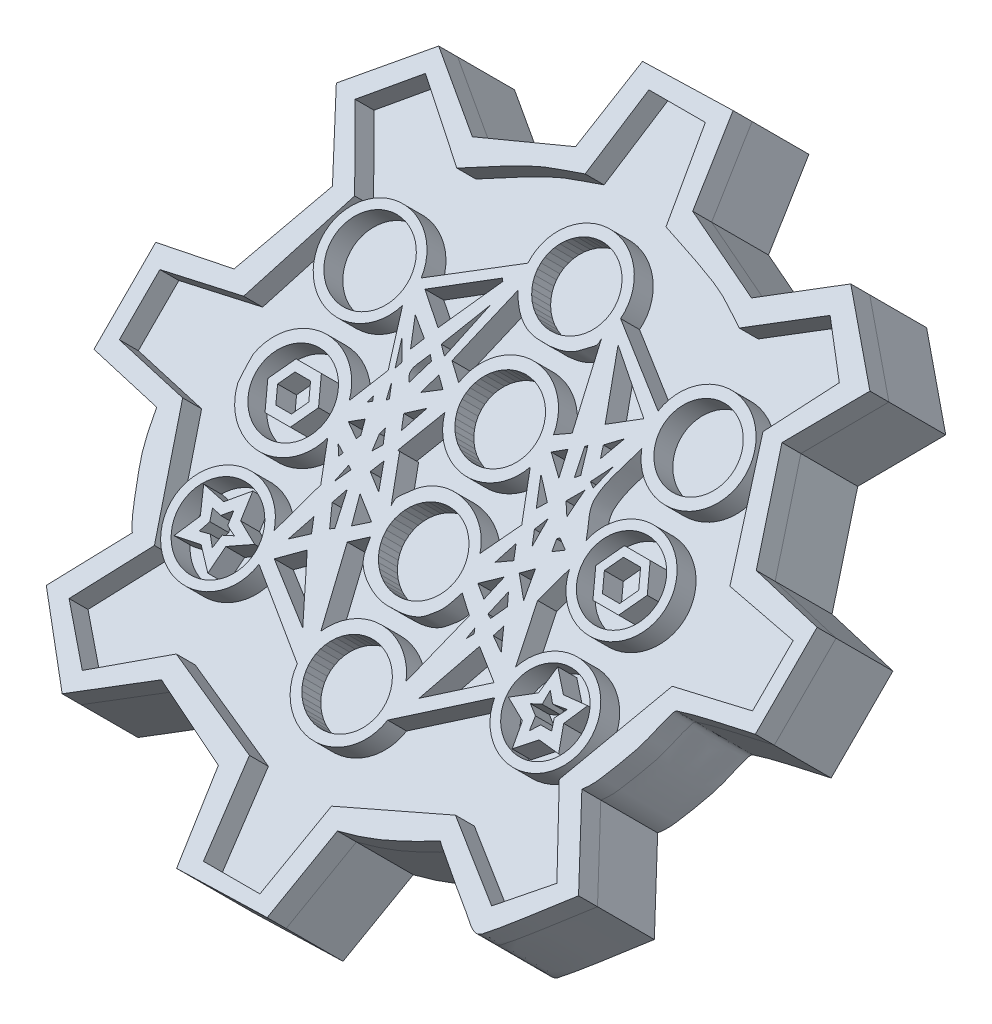
from build123d import *

# Parameters (mm, degrees)
SKETCH3_R                       = 12.7
BOSS_EXTRUDE1_DEPTH             = 4.7625
BOSS_EXTRUDE2_REACH             = 31.48
SKETCH2_R                       = 6.0325
BOSS_EXTRUDE2_DIRECTION_2_DEPTH = 3.175
BOSS_EXTRUDE3_DEPTH             = 4.7625
BOSS_EXTRUDE4_DEPTH             = 1.5875
SKETCH5_3_R                     = 2.164212429
SKETCH5_3_R_2                   = 2.267249673
SKETCH5_3_R_3                   = 2.236755997
SKETCH5_3_R_4                   = 2.162543778
SKETCH5_3_R_5                   = 2.19194465
SKETCH5_3_R_6                   = 2.185022377
BOSS_EXTRUDE4_2_DEPTH           = 1.5875
BOSS_EXTRUDE4_3_DEPTH           = 1.5875
BOSS_EXTRUDE4_4_DEPTH           = 1.5875
BOSS_EXTRUDE4_5_DEPTH           = 1.5875
BOSS_EXTRUDE4_6_DEPTH           = 1.5875
SKETCH6_R                       = 2.999994
CUT_EXTRUDE1_DEPTH              = 3


with BuildPart() as part:
    # Sketch3 → Boss-Extrude1 (new body)
    with BuildSketch(Plane(origin=(0, 0, 0), x_dir=(1, 0, 0), z_dir=(0, 0.7071067811865464, 0.7071067811865488))):
        Circle(SKETCH3_R)
    extrude(amount=BOSS_EXTRUDE1_DEPTH)

    # Boss-Extrude2: up to this plane
    boss_extrude2_end = Plane(origin=(0, 0, 0), z_dir=(0, 0.7071067811865464, 0.7071067811865488))
    # Sketch2 → Boss-Extrude2 (add, up to the surface)
    with BuildSketch(Plane(origin=(0, -6.35, 0), x_dir=(1, 0, 0), z_dir=(0, 1, 0)), mode=Mode.PRIVATE) as boss_extrude2_sk1:
        Circle(SKETCH2_R)
    boss_extrude2_tool1 = split(extrude(boss_extrude2_sk1.sketch, amount=BOSS_EXTRUDE2_REACH, mode=Mode.PRIVATE), bisect_by=boss_extrude2_end, keep=Keep.BOTH, mode=Mode.PRIVATE)
    add(boss_extrude2_tool1.solids().sort_by_distance((0, -6.35, 0))[0])

    # Sketch2 → Boss-Extrude2 direction 2 (add)
    with BuildSketch(Plane(origin=(0, -6.35, 0), x_dir=(1, 0, 0), z_dir=(0, 1, 0))):
        Circle(SKETCH2_R)
    extrude(amount=-BOSS_EXTRUDE2_DIRECTION_2_DEPTH)

    # Sketch5 → Boss-Extrude3 (add)
    with BuildSketch(Plane(origin=(0, 3.367596045, 3.367596045), x_dir=(1, 0, 0), z_dir=(0, 0.7071067811865465, 0.7071067811865487))):
        with BuildLine():
            Line((2.37588296, -19.954888549), (3.27588296, -15.342388549))
            add(Edge.make_bspline(
                [(3.27588296, -15.342388549), (5.213140651, -14.95493701), (6.365125302, -14.416517378), (8.11338296, -13.542388549)],
                knots=[0, 0, 0, 0, 1, 1, 1, 1], degree=3))
            add(Edge.make_bspline(
                [(8.11338296, -13.542388549), (8.15088296, -13.579888549), (8.182279635, -13.624701631), (8.22588296, -13.654888549), (9.105957707, -14.264171065), (10.140890335, -14.984018342), (11.03838296, -15.567388549), (11.335002757, -15.760191417), (11.602763198, -16.018015294), (11.93838296, -16.129888549), (12.085065014, -16.178782567), (12.275691051, -16.123250645), (12.38838296, -16.017388549), (13.528810411, -14.946077913), (14.56338296, -13.767388549), (15.65088296, -12.642388549)],
                knots=[0, 0, 0, 0, 1, 1, 1, 2, 2, 2, 3, 3, 3, 4, 4, 4, 5, 5, 5, 5], degree=3))
            Line((15.65088296, -12.642388549), (13.06338296, -8.704888549))
            add(Edge.make_bspline(
                [(13.06338296, -8.704888549), (13.291037029, -8.47723448), (13.486673387, -8.195807695), (13.62588296, -7.917388549), (13.940972233, -7.287210002), (14.267644067, -6.660418047), (14.52588296, -6.004888549), (14.756285605, -5.420020297), (14.871067542, -4.794744683), (15.08838296, -4.204888549), (15.13512515, -4.07801689), (15.182626579, -3.901798123), (15.31338296, -3.867388549), (16.643385158, -3.51738797), (18.01338296, -3.342388549), (19.36338296, -3.079888549)],
                knots=[0, 0, 0, 0, 1, 1, 1, 2, 2, 2, 3, 3, 3, 4, 4, 4, 5, 5, 5, 5], degree=3))
            Line((19.36338296, -3.079888549), (19.36338296, 2.095111451))
            Line((19.36338296, 2.095111451), (15.20088296, 2.882611451))
            Line((15.20088296, 2.882611451), (13.06338296, 8.057611451))
            Line((13.06338296, 8.057611451), (15.65088296, 11.770111451))
            Line((15.65088296, 11.770111451), (12.05088296, 15.257611451))
            Line((12.05088296, 15.257611451), (8.00088296, 12.670111451))
            Line((8.00088296, 12.670111451), (3.16338296, 14.582611451))
            Line((3.16338296, 14.582611451), (2.37588296, 19.082611451))
            Line((2.37588296, 19.082611451), (-2.91161704, 18.970111451))
            Line((-2.91161704, 18.970111451), (-3.69911704, 14.470111451))
            Line((-3.69911704, 14.470111451), (-8.53661704, 12.670111451))
            Line((-8.53661704, 12.670111451), (-12.36161704, 15.257611451))
            Line((-12.36161704, 15.257611451), (-15.96161704, 11.770111451))
            Line((-15.96161704, 11.770111451), (-13.48661704, 7.945111451))
            Line((-13.48661704, 7.945111451), (-15.73661704, 2.882611451))
            Line((-15.73661704, 2.882611451), (-19.89911704, 2.207611451))
            Line((-19.89911704, 2.207611451), (-19.89911704, -2.967388549))
            Line((-19.89911704, -2.967388549), (-15.62411704, -3.754888549))
            add(Edge.make_bspline(
                [(-15.62411704, -3.754888549), (-15.432011284, -4.715417329), (-15.179098428, -5.714298445), (-14.72411704, -6.567388549), (-14.604852353, -6.791009836), (-13.923408311, -8.380597277), (-13.48661704, -8.817388549)],
                knots=[0, 0, 0, 0, 1, 1, 1, 2, 2, 2, 2], degree=3))
            Line((-13.48661704, -8.817388549), (-15.96161704, -12.529888549))
            Line((-15.96161704, -12.529888549), (-12.47411704, -16.129888549))
            Line((-12.47411704, -16.129888549), (-8.42411704, -13.542388549))
            Line((-8.42411704, -13.542388549), (-3.69911704, -15.454888549))
            Line((-3.69911704, -15.454888549), (-2.91161704, -20.067388549))
            Line((-2.91161704, -20.067388549), (2.37588296, -19.954888549))
        make_face()
    extrude(amount=-BOSS_EXTRUDE3_DEPTH)

    # Sketch6 → Cut-Extrude1 (cut)
    with BuildSketch(Plane(origin=(0, 0, 0), x_dir=(1, 0, 0), z_dir=(0, -0.7071067811865465, -0.7071067811865487))):
        with Locations((0, -12.7)):
            Circle(SKETCH6_R)
    extrude(amount=-CUT_EXTRUDE1_DEPTH, mode=Mode.SUBTRACT)


with BuildPart() as body_2:
    # Sketch5<3> → Boss-Extrude4 (new body)
    with BuildSketch(Plane(origin=(0, 3.367596045, 3.367596045), x_dir=(1, 0, 0), z_dir=(0, 0.7071067811865465, 0.7071067811865487))):
        Polygon((10.570890724, -6.699628222), (11.181545438, -5.554406631), (9.824774814, -5.667338587), (8.852559914, -4.767388549), (8.666425604, -6.118183773), (7.439656446, -6.909637779), (8.666425604, -7.467473287), (8.932946283, -8.704888549), (9.906098908, -7.810704156), (11.123321766, -7.911532023), align=None)
        Polygon((9.122543013, -6.456478997), (9.122543013, -5.779888549), (9.579223769, -6.227001566), (10.374688716, -6.118183773), (10.011049339, -6.699628222), (10.232974046, -7.236125629), (9.579223769, -7.236125629), (9.234575608, -7.689732748), (9.122543013, -7.017537179), (8.582576814, -6.679838587), align=None, mode=Mode.SUBTRACT)
    extrude(amount=BOSS_EXTRUDE4_DEPTH)


with BuildPart() as body_3:
    # Sketch5<3> → Boss-Extrude4 2 (new body)
    with BuildSketch(Plane(origin=(0, 3.367596045, 3.367596045), x_dir=(1, 0, 0), z_dir=(0, 0.7071067811865465, 0.7071067811865487))):
        with BuildLine():
            Line((6.988377513, -5.667338587), (6.257391832, -2.786733685))
            Line((6.257391832, -2.786733685), (6.867974577, -0.979023088))
            ThreePointArc((6.867974577, -0.979023088), (12.159341193, -0.315814658), (6.875877513, 0.407661413))
            add(Edge.make_bspline(
                [(6.875877513, 0.407661413), (6.646620756, 0.973201954), (6.172855969, 1.494232085), (6.188107242, 2.104283035), (6.212394376, 3.075768384), (6.721620756, 3.973201954), (6.988377513, 4.907661413)],
                knots=[0, 0, 0, 0, 1, 1, 1, 2, 2, 2, 2], degree=3))
            ThreePointArc((6.988377513, 4.907661413), (12.246789662, 6.50864779), (6.750977209, 6.609152497))
            Line((6.750977209, 6.609152497), (2.713377513, 9.176441506))
            ThreePointArc((2.713377513, 9.176441506), (-0.017601471, 12.204350888), (-2.827037997, 9.249093227))
            Line((-2.827037997, 9.249093227), (-7.186622487, 6.474842305))
            ThreePointArc((-7.186622487, 6.474842305), (-12.644887327, 6.28918741), (-7.315855358, 5.093971497))
            Line((-7.315855358, 5.093971497), (-6.286622487, 2.432661413))
            Line((-6.286622487, 2.432661413), (-7.240094631, 0.520111451))
            ThreePointArc((-7.240094631, 0.520111451), (-10.092764681, 2.447488248), (-12.698465553, 0.197414763))
            ThreePointArc((-12.698465553, 0.197414763), (-12.690708308, -0.485718674), (-12.646227442, -1.167446567))
            ThreePointArc((-12.646227442, -1.167446567), (-9.984507764, -3.211589629), (-7.240094631, -1.279888549))
            Line((-7.240094631, -1.279888549), (-6.345896802, -3.132498155))
            Line((-6.345896802, -3.132498155), (-7.240094631, -5.779888549))
            ThreePointArc((-7.240094631, -5.779888549), (-12.551776002, -7.198833198), (-7.054876576, -7.305882736))
            Line((-7.054876576, -7.305882736), (-2.79911704, -10.115380309))
            ThreePointArc((-2.79911704, -10.115380309), (-0.134807774, -12.572630384), (2.66194435, -10.267245524))
            Line((2.66194435, -10.267245524), (6.843032471, -7.211437421))
            ThreePointArc((6.843032471, -7.211437421), (12.138764723, -6.931031297), (6.988377513, -5.667338587))
        make_face()
        with Locations((9.470174405, -6.679838587)):
            Circle(SKETCH5_3_R, mode=Mode.SUBTRACT)
        Polygon((2.086283035, 8.892595719), (1.995970472, 8.618267693), (1.869075517, 8.358352817), (1.707862615, 8.117489279), (1.515208612, 7.899975294), (1.294551424, 7.709692405), (1.049828685, 7.550036214), (0.785407476, 7.42385579), (0.506006401, 7.333402825), (0.216611379, 7.280291454), (-0.077613329, 7.265469452), (-0.371417277, 7.289201317), (-0.659557526, 7.351063554), (-0.936892207, 7.449952229), (-1.198472275, 7.584102672), (-1.439629828, 7.751120965), (-1.656061404, 7.948026663), (-1.843904777, 8.171305978), (-1.999807876, 8.416974486), (-2.120988607, 8.680648227), (-2.205284497, 8.957621936), (-2.251191285, 9.242953011), (-2.257889762, 9.531549713), (-2.225260394, 9.818262026), (-2.153885452, 10.097973563), (-2.045038625, 10.365692863), (-1.900662287, 10.616642471), (-1.723332836, 10.846344184), (-1.516214721, 11.05069897), (-1.283003969, 11.226060113), (-1.027862233, 11.369298289), (-0.755342521, 11.47785741), (-0.470307956, 11.549800234), (-0.177844985, 11.583842942), (0.116827382, 11.57937804), (0.408450711, 11.536485204), (0.691820976, 11.455929858), (0.961881428, 11.339149514), (1.213812832, 11.188228121), (1.443119466, 11.005858873), (1.645709348, 10.795296155), (1.817967257, 10.560297462), (1.956819245, 10.305056353), (2.059787497, 10.034127612), (2.12503454, 9.752345967), (2.151396041, 9.464739819), (2.138401577, 9.176441506), align=None, mode=Mode.SUBTRACT)
        with Locations((-9.79576947, -6.864321983)):
            Circle(SKETCH5_3_R_2, mode=Mode.SUBTRACT)
        with Locations((-9.903872161, 6.032661413)):
            Circle(SKETCH5_3_R_3, mode=Mode.SUBTRACT)
        with Locations((9.490932706, 6.124137237)):
            Circle(SKETCH5_3_R_4, mode=Mode.SUBTRACT)
        Polygon((-6.51161704, -6.792388549), (-5.27411704, -5.779888549), (-3.47411704, -8.704888549), align=None, mode=Mode.SUBTRACT)
        Polygon((-6.39911704, -5.779888549), (-5.83661704, -4.429888549), (-5.49911704, -5.104888549), align=None, mode=Mode.SUBTRACT)
        Polygon((-5.83661704, -2.742388549), (-5.61161704, -1.842388549), (-5.38661704, -1.954888549), align=None, mode=Mode.SUBTRACT)
        Polygon((-6.28661704, -1.729888549), (-6.62411704, -1.279888549), (-6.17411704, -1.504888549), align=None, mode=Mode.SUBTRACT)
        Polygon((-5.04911704, -2.742388549), (-4.59911704, -4.429888549), (-4.82411704, -4.542388549), (-5.38661704, -3.529888549), align=None, mode=Mode.SUBTRACT)
        Polygon((-3.92411704, -3.979888549), (-4.37411704, -2.629888549), (-3.13661704, -3.417388549), align=None, mode=Mode.SUBTRACT)
        Polygon((-4.48661704, -1.617388549), (-4.14911704, -0.942388549), (-3.58661704, -2.179888549), align=None, mode=Mode.SUBTRACT)
        Polygon((2.147744199, -9.976082924), (2.10982956, -10.257453458), (2.034819966, -10.531279057), (1.923998852, -10.792874487), (1.779262397, -11.037763779), (1.603087082, -11.261756809), (1.398487315, -11.461020993), (1.168963856, -11.632146868), (0.918443914, -11.772206421), (0.651213956, -11.878803194), (0.371846359, -11.950113288), (0.085121181, -11.984916567), (-0.204055631, -11.982617537), (-0.490736181, -11.943255535), (-0.770015287, -11.867504056), (-1.037114404, -11.756659229), (-1.287463393, -11.612617639), (-1.516778713, -11.437843878), (-1.721136716, -11.235328374), (-1.89704078, -11.008536222), (-2.041481136, -10.7613479), (-2.151986372, -10.497992868), (-2.22666571, -10.222977204), (-2.264241368, -9.941006503), (-2.264070416, -9.65690536), (-2.226155778, -9.375534825), (-2.151146184, -9.101709227), (-2.040325069, -8.840113797), (-1.895588614, -8.595224505), (-1.719413299, -8.371231475), (-1.514813532, -8.17196729), (-1.285290073, -8.000841416), (-1.034770132, -7.860781863), (-0.767540173, -7.754185089), (-0.488172576, -7.682874995), (-0.201447398, -7.648071716), (0.087729414, -7.650370746), (0.374409964, -7.689732748), (0.653689069, -7.765484227), (0.920788186, -7.876329055), (1.171137175, -8.020370645), (1.400452496, -8.195144406), (1.604810499, -8.39765991), (1.780714562, -8.624452061), (1.925154919, -8.871640383), (2.035660154, -9.134995415), (2.110339493, -9.410011079), (2.147915151, -9.691981781), align=None, mode=Mode.SUBTRACT)
        with BuildLine():
            Line((2.71338296, -4.092388549), (3.61338296, -4.767388549))
            Line((3.61338296, -4.767388549), (2.48838296, -8.479888549))
            ThreePointArc((2.48838296, -8.479888549), (-0.037226803, -6.940564194), (-2.584979764, -8.442955287))
            Line((-2.584979764, -8.442955287), (-3.69911704, -4.654888549))
            Line((-3.69911704, -4.654888549), (-2.79911704, -3.979888549))
            add(Edge.make_bspline(
                [(-2.79911704, -3.979888549), (-2.72411704, -4.279888549), (-2.702078533, -4.598373263), (-2.57411704, -4.879888549), (-2.244749101, -5.604498013), (-1.049876309, -6.117388549), (-0.32411704, -6.117388549), (0.281227234, -6.117388549), (1.174640055, -6.141007164), (1.70088296, -5.667388549), (2.40158335, -5.036758198), (2.371991785, -4.888967958), (2.71338296, -4.092388549)],
                knots=[0, 0, 0, 0, 1, 1, 1, 2, 2, 2, 3, 3, 3, 4, 4, 4, 4], degree=3))
        make_face(mode=Mode.SUBTRACT)
        Polygon((4.28838296, -5.329888549), (4.06338296, -5.667388549), (4.17588296, -5.104888549), align=None, mode=Mode.SUBTRACT)
        Polygon((3.50088296, -8.817388549), (4.85088296, -5.667388549), (6.42588296, -6.679888549), align=None, mode=Mode.SUBTRACT)
        Polygon((2.143239875, -3.246781578), (2.144666797, -3.535728761), (2.106749627, -3.82218085), (2.030164996, -4.101026099), (1.916279561, -4.367288509), (1.767125608, -4.616216622), (1.585364794, -4.843368308), (1.374240645, -5.04469004), (1.137520676, -5.216589228), (0.879429161, -5.355998326), (0.604571749, -5.460429576), (0.317853277, -5.5280194), (0.024390243, -5.557561655), (-0.270580499, -5.548529159), (-0.561795188, -5.501083098), (-0.844057091, -5.416070147), (-1.112329239, -5.295007365), (-1.361824307, -5.14005512), (-1.588090052, -4.953978538), (-1.787088755, -4.740098161), (-1.955269279, -4.502230688), (-2.08963044, -4.244620871), (-2.187774558, -3.971865762), (-2.247950251, -3.688832684), (-2.269083681, -3.400572368), (-2.250797722, -3.112228826), (-2.193418687, -2.828947555), (-2.097970507, -2.555783717), (-1.966156456, -2.297611927), (-1.800328759, -2.059039266), (-1.603446616, -1.84432307), (-1.379023393, -1.657294953), (-1.131063927, -1.501292437), (-0.863993062, -1.379099391), (-0.582576683, -1.292896353), (-0.291836672, -1.244221617), (0.003038708, -1.233943786), (0.2967874, -1.262246267), (0.584167451, -1.328624002), (0.860050557, -1.43189248), (1.119513577, -1.57020887), (1.357926388, -1.741104915), (1.571034508, -1.941530971), (1.755035017, -2.167910429), (1.906644422, -2.416203542), (2.023157249, -2.681979515), (2.102494324, -2.960495569), align=None, mode=Mode.SUBTRACT)
        Polygon((3.16338296, -3.417388549), (4.17588296, -2.629888549), (3.83838296, -3.867388549), align=None, mode=Mode.SUBTRACT)
        Polygon((3.38838296, -2.292388549), (3.83838296, -1.167388549), (4.17588296, -1.842388549), align=None, mode=Mode.SUBTRACT)
        Polygon((5.18838296, -4.992388549), (5.41338296, -4.429888549), (5.97588296, -5.442388549), align=None, mode=Mode.SUBTRACT)
        Polygon((4.73838296, -3.079888549), (5.07588296, -3.642388549), (4.62588296, -4.429888549), (4.40088296, -4.317388549), align=None, mode=Mode.SUBTRACT)
        Polygon((5.63838296, -3.079888549), (4.738381017, -2.179886172), (5.346979202, -1.682292834), align=None, mode=Mode.SUBTRACT)
        with Locations((-9.925611304, -0.379888549)):
            Circle(SKETCH5_3_R_5, mode=Mode.SUBTRACT)
        Polygon((-6.06161704, 0.182611451), (-5.83661704, -0.492388549), (-5.94911704, -0.717388549), (-6.73661704, -0.267388549), align=None, mode=Mode.SUBTRACT)
        Polygon((-6.39911704, 0.857611451), (-6.28661704, 1.195111451), (-6.17411704, 0.970111451), align=None, mode=Mode.SUBTRACT)
        Polygon((-5.61161704, 1.307611451), (-5.83661704, 2.095111451), (-5.49911704, 1.420111451), align=None, mode=Mode.SUBTRACT)
        Polygon((-6.033027308, 2.657611451), (-6.51161704, 3.895111451), (-5.885439958, 3.001981935), align=None, mode=Mode.SUBTRACT)
        Polygon((-5.83661704, 3.670111451), (-6.51161704, 5.020111451), (-5.49911704, 4.345111451), align=None, mode=Mode.SUBTRACT)
        Polygon((-4.93661704, 0.295111451), (-4.59911704, -0.379888549), (-4.93661704, -0.829888549), (-5.04911704, -0.042388549), align=None, mode=Mode.SUBTRACT)
        Polygon((-4.48661704, 1.195111451), (-3.58661704, 1.870111451), (-4.14911704, 0.520111451), align=None, mode=Mode.SUBTRACT)
        with BuildLine():
            add(Edge.make_bspline(
                [(-5.04911704, 2.432611451), (-5.534077752, 2.917572164), (-5.084789319, 3.308598822), (-4.82411704, 3.895111451)],
                knots=[0, 0, 0, 0, 1, 1, 1, 1], degree=3))
            Line((-4.82411704, 3.895111451), (-4.59911704, 3.670111451))
            Line((-4.59911704, 3.670111451), (-5.04911704, 2.432611451))
        make_face(mode=Mode.SUBTRACT)
        Polygon((-4.26161704, 2.320111451), (-3.92411704, 3.332611451), (-3.36161704, 2.882611451), align=None, mode=Mode.SUBTRACT)
        Polygon((-4.59911704, 4.492982269), (-3.423837336, 6.9255138), (-4.14911704, 4.120111451), align=None, mode=Mode.SUBTRACT)
        Polygon((-3.58661704, 8.170111451), (-3.47411704, 8.057611451), (-5.16161704, 5.020111451), (-6.73661704, 6.145111451), align=None, mode=Mode.SUBTRACT)
        with BuildLine():
            ThreePointArc((-2.68661704, 2.095111451), (-0.156302139, 0.21820356), (2.506576456, 1.901757632))
            Line((2.506576456, 1.901757632), (3.61338296, -0.379888549))
            Line((3.61338296, -0.379888549), (2.48838296, -2.292388549))
            add(Edge.make_bspline(
                [(2.48838296, -2.292388549), (1.799772389, -0.57086212), (-0.800285482, 0.051791332), (-2.12411704, -1.392388549), (-2.706492, -2.027706687), (-2.68661704, -1.970041264), (-2.68661704, -2.404888549)],
                knots=[0, 0, 0, 0, 1, 1, 1, 2, 2, 2, 2], degree=3))
            Line((-2.68661704, -2.404888549), (-3.69911704, -0.267388549))
            Line((-3.69911704, -0.267388549), (-3.81161704, -0.267388549))
            Line((-3.81161704, -0.267388549), (-2.68661704, 2.095111451))
        make_face(mode=Mode.SUBTRACT)
        Polygon((4.28838296, -0.267388549), (4.62588296, 0.407611451), (4.62588296, -0.942388549), align=None, mode=Mode.SUBTRACT)
        Polygon((3.83838296, 0.520111451), (3.16338296, 1.870111451), (4.17588296, 0.970111451), align=None, mode=Mode.SUBTRACT)
        Polygon((2.146014273, 3.211428094), (2.155332248, 2.922453784), (2.125248619, 2.634898655), (2.05630023, 2.353894137), (1.949717466, 2.084454761), (1.807402299, 1.831388679), (1.631894347, 1.599211861), (1.426325553, 1.392067509), (1.194364297, 1.213652117), (0.940149934, 1.067149514), (0.668218924, 0.955174041), (0.383423883, 0.879723903), (0.090846985, 0.84214551), (-0.204290727, 0.84310945), (-0.496722516, 0.88259852), (-0.781229928, 0.959908037), (-1.052735921, 1.073658411), (-1.306395466, 1.221819765), (-1.537682002, 1.401748154), (-1.742468214, 1.610232753), (-1.917099688, 1.84355315), (-2.058460121, 2.097545735), (-2.164026933, 2.367678006), (-2.231916282, 2.649129446), (-2.26091668, 2.936877546), (-2.250510615, 3.225787436), (-2.200883784, 3.510703511), (-2.112921777, 3.786541438), (-1.98819428, 4.048378882), (-1.828927058, 4.291543348), (-1.637962237, 4.51169556), (-1.41870759, 4.704906896), (-1.175075721, 4.867729496), (-0.911414246, 4.997257787), (-0.632428211, 5.091180332), (-0.343096128, 5.147821083), (-0.048581135, 5.166169284), (0.245861141, 5.14589751), (0.53497637, 5.087367511), (0.813605286, 4.991623758), (1.076775746, 4.860374799), (1.31979147, 4.695962776), (1.538315835, 4.501321624), (1.728449269, 4.27992472), (1.886798837, 4.035722897), (2.010538786, 3.773073942), (2.097460974, 3.496664832), align=None, mode=Mode.SUBTRACT)
        Polygon((3.05088296, 2.882611451), (3.72588296, 3.332611451), (4.06338296, 2.095111451), align=None, mode=Mode.SUBTRACT)
        Polygon((5.63838296, -0.042388549), (6.20088296, -0.379888549), (5.63838296, -0.717388549), (5.52588296, -0.154888549), align=None, mode=Mode.SUBTRACT)
        Polygon((4.96338296, 1.420111451), (5.52588296, 2.207611451), (5.41338296, 0.857611451), align=None, mode=Mode.SUBTRACT)
        with Locations((9.470174405, -0.300488668)):
            Circle(SKETCH5_3_R_6, mode=Mode.SUBTRACT)
        Polygon((4.51338296, 3.895111451), (4.96338296, 2.657611451), (4.73838296, 2.432611451), (4.40088296, 3.782611451), align=None, mode=Mode.SUBTRACT)
        Polygon((5.555032171, 2.634015446), (6.20088296, 3.670111451), (5.850584864, 2.449782577), align=None, mode=Mode.SUBTRACT)
        Polygon((5.41338296, 3.670111451), (5.18838296, 4.232611451), (5.97588296, 4.907611451), align=None, mode=Mode.SUBTRACT)
        with BuildLine():
            Line((-2.836449285, 3.460448099), (-3.69911704, 4.120111451))
            Line((-3.69911704, 4.120111451), (-2.57411704, 8.057611451))
            add(Edge.make_bspline(
                [(-2.57411704, 8.057611451), (-2.104555386, 7.35326897), (-1.472413375, 6.784552813), (-0.54911704, 6.707611451), (0.036130665, 6.658840809), (1.139737372, 6.652580422), (1.70088296, 7.157611451), (2.400287637, 7.78707566), (2.37588296, 7.619608158), (2.37588296, 8.057611451)],
                knots=[0, 0, 0, 0, 1, 1, 1, 2, 2, 2, 3, 3, 3, 3], degree=3))
            Line((2.37588296, 8.057611451), (3.50088296, 4.007611451))
            Line((3.50088296, 4.007611451), (2.71338296, 3.557611451))
            ThreePointArc((2.71338296, 3.557611451), (-0.102042107, 5.822842974), (-2.836449285, 3.460448099))
        make_face(mode=Mode.SUBTRACT)
        Polygon((4.73838296, 5.020111451), (3.27588296, 8.170111451), (6.31338296, 6.032611451), align=None, mode=Mode.SUBTRACT)
    extrude(amount=BOSS_EXTRUDE4_2_DEPTH)


with BuildPart() as body_4:
    # Sketch5<3> → Boss-Extrude4 3 (new body)
    with BuildSketch(Plane(origin=(0, 3.367596045, 3.367596045), x_dir=(1, 0, 0), z_dir=(0, 0.7071067811865465, 0.7071067811865487))):
        Polygon((-10.223239103, -5.779888549), (-11.565133918, -5.554406631), (-10.89418651, -6.792388549), (-11.565133918, -8.050683032), (-10.125260658, -7.810704156), (-9.093916405, -8.704888549), (-8.982373433, -7.358309879), (-7.75416355, -6.67676448), (-8.982373433, -6.118273846), (-9.205459377, -4.779758182), align=None)
        Polygon((-9.994219036, -7.236125629), (-10.561502054, -7.358309879), (-10.328724005, -6.792388549), (-10.561502054, -6.229653462), (-10.007255874, -6.343684972), (-9.548477936, -5.892862721), (-9.437098321, -6.561140411), (-8.874896454, -6.792388549), (-9.437098321, -7.026887009), (-9.548477936, -7.689732748), align=None, mode=Mode.SUBTRACT)
    extrude(amount=BOSS_EXTRUDE4_3_DEPTH)


with BuildPart() as body_5:
    # Sketch5<3> → Boss-Extrude4 4 (new body)
    with BuildSketch(Plane(origin=(0, 3.367596045, 3.367596045), x_dir=(1, 0, 0), z_dir=(0, 0.7071067811865465, 0.7071067811865487))):
        Polygon((8.707374763, 1.020719067), (7.944575122, -0.300488668), (8.707374763, -1.621696403), (10.232974046, -1.621696403), (10.995773687, -0.300488668), (10.232974046, 1.020719067), align=None)
        Polygon((9.978680341, 0.58026945), (10.487186278, -0.300488668), (9.978680341, -1.181246786), (8.961668468, -1.181246786), (8.453162531, -0.300488668), (8.961668468, 0.58026945), align=None, mode=Mode.SUBTRACT)
    extrude(amount=BOSS_EXTRUDE4_4_DEPTH)


with BuildPart() as body_6:
    # Sketch5<3> → Boss-Extrude4 5 (new body)
    with BuildSketch(Plane(origin=(0, 3.367596045, 3.367596045), x_dir=(1, 0, 0), z_dir=(0, 0.7071067811865465, 0.7071067811865487))):
        Polygon((-10.676358436, 0.920443628), (-11.427105569, -0.379888549), (-10.676358436, -1.680220725), (-9.174864172, -1.680220725), (-8.42411704, -0.379888549), (-9.174864172, 0.920443628), align=None)
        Polygon((-9.463498762, 0.420513853), (-9.00138622, -0.379888549), (-9.463498762, -1.18029095), (-10.387723846, -1.18029095), (-10.849836388, -0.379888549), (-10.387723846, 0.420513853), align=None, mode=Mode.SUBTRACT)
    extrude(amount=BOSS_EXTRUDE4_5_DEPTH)


with BuildPart() as body_7:
    # Sketch5<3> → Boss-Extrude4 6 (new body)
    with BuildSketch(Plane(origin=(0, 3.367596045, 3.367596045), x_dir=(1, 0, 0), z_dir=(0, 0.7071067811865465, 0.7071067811865487))):
        with BuildLine():
            Line((-2.91161704, -20.067388549), (2.37588296, -19.954888549))
            Line((2.37588296, -19.954888549), (3.27588296, -15.342388549))
            add(Edge.make_bspline(
                [(3.27588296, -15.342388549), (5.213140651, -14.95493701), (6.365125302, -14.416517378), (8.11338296, -13.542388549)],
                knots=[0, 0, 0, 0, 1, 1, 1, 1], degree=3))
            add(Edge.make_bspline(
                [(8.11338296, -13.542388549), (8.15088296, -13.579888549), (8.182279635, -13.624701631), (8.22588296, -13.654888549), (9.105957707, -14.264171065), (10.140890335, -14.984018342), (11.03838296, -15.567388549), (11.335002757, -15.760191417), (11.602763198, -16.018015294), (11.93838296, -16.129888549), (12.085065014, -16.178782567), (12.275691051, -16.123250645), (12.38838296, -16.017388549), (13.528810411, -14.946077913), (14.56338296, -13.767388549), (15.65088296, -12.642388549)],
                knots=[0, 0, 0, 0, 1, 1, 1, 2, 2, 2, 3, 3, 3, 4, 4, 4, 5, 5, 5, 5], degree=3))
            Line((15.65088296, -12.642388549), (13.06338296, -8.704888549))
            add(Edge.make_bspline(
                [(13.06338296, -8.704888549), (13.291037029, -8.47723448), (13.486673387, -8.195807695), (13.62588296, -7.917388549), (13.940972233, -7.287210002), (14.267644067, -6.660418047), (14.52588296, -6.004888549), (14.756285605, -5.420020297), (14.871067542, -4.794744683), (15.08838296, -4.204888549), (15.13512515, -4.07801689), (15.182626579, -3.901798123), (15.31338296, -3.867388549), (16.643385158, -3.51738797), (18.01338296, -3.342388549), (19.36338296, -3.079888549)],
                knots=[0, 0, 0, 0, 1, 1, 1, 2, 2, 2, 3, 3, 3, 4, 4, 4, 5, 5, 5, 5], degree=3))
            Line((19.36338296, -3.079888549), (19.36338296, 2.095111451))
            Line((19.36338296, 2.095111451), (15.20088296, 2.882611451))
            Line((15.20088296, 2.882611451), (13.06338296, 8.057611451))
            Line((13.06338296, 8.057611451), (15.65088296, 11.770111451))
            Line((15.65088296, 11.770111451), (12.05088296, 15.257611451))
            Line((12.05088296, 15.257611451), (8.00088296, 12.670111451))
            Line((8.00088296, 12.670111451), (3.16338296, 14.582611451))
            Line((3.16338296, 14.582611451), (2.37588296, 19.082611451))
            Line((2.37588296, 19.082611451), (-2.91161704, 18.970111451))
            Line((-2.91161704, 18.970111451), (-3.69911704, 14.470111451))
            Line((-3.69911704, 14.470111451), (-8.53661704, 12.670111451))
            Line((-8.53661704, 12.670111451), (-12.36161704, 15.257611451))
            Line((-12.36161704, 15.257611451), (-15.96161704, 11.770111451))
            Line((-15.96161704, 11.770111451), (-13.48661704, 7.945111451))
            Line((-13.48661704, 7.945111451), (-15.73661704, 2.882611451))
            Line((-15.73661704, 2.882611451), (-19.89911704, 2.207611451))
            Line((-19.89911704, 2.207611451), (-19.89911704, -2.967388549))
            Line((-19.89911704, -2.967388549), (-15.62411704, -3.754888549))
            add(Edge.make_bspline(
                [(-15.62411704, -3.754888549), (-15.432011284, -4.715417329), (-15.179098428, -5.714298445), (-14.72411704, -6.567388549), (-14.604852353, -6.791009836), (-13.923408311, -8.380597277), (-13.48661704, -8.817388549)],
                knots=[0, 0, 0, 0, 1, 1, 1, 2, 2, 2, 2], degree=3))
            Line((-13.48661704, -8.817388549), (-15.96161704, -12.529888549))
            Line((-15.96161704, -12.529888549), (-12.47411704, -16.129888549))
            Line((-12.47411704, -16.129888549), (-8.42411704, -13.542388549))
            Line((-8.42411704, -13.542388549), (-3.69911704, -15.454888549))
            Line((-3.69911704, -15.454888549), (-2.91161704, -20.067388549))
        make_face()
        with BuildLine():
            Line((-14.61161704, 2.095111451), (-12.24911704, 8.057611451))
            Line((-12.24911704, 8.057611451), (-14.711357328, 11.572239208))
            Line((-14.711357328, 11.572239208), (-12.24911704, 13.985315798))
            Line((-12.24911704, 13.985315798), (-8.42411704, 11.207611451))
            add(Edge.make_bspline(
                [(-8.42411704, 11.207611451), (-7.29911704, 11.770111451), (-6.207498815, 12.405026854), (-5.04911704, 12.895111451), (-4.251785287, 13.232444116), (-3.39911704, 13.420111451), (-2.57411704, 13.682611451)],
                knots=[0, 0, 0, 0, 1, 1, 1, 2, 2, 2, 2], degree=3))
            Line((-2.57411704, 13.682611451), (-1.89911704, 18.070111451))
            Line((-1.89911704, 18.070111451), (1.444911988, 18.070111451))
            Line((1.444911988, 18.070111451), (2.37588296, 13.457611451))
            add(Edge.make_bspline(
                [(2.37588296, 13.457611451), (3.65088296, 13.082611451), (4.952596696, 12.788716048), (6.20088296, 12.332611451), (6.909720784, 12.073613016), (7.55088296, 11.657611451), (8.22588296, 11.320111451)],
                knots=[0, 0, 0, 0, 1, 1, 1, 2, 2, 2, 2], degree=3))
            Line((8.22588296, 11.320111451), (11.93838296, 13.682611451))
            Line((11.93838296, 13.682611451), (14.07588296, 11.432611451))
            Line((14.07588296, 11.432611451), (11.93838296, 8.057611451))
            Line((11.93838296, 8.057611451), (14.436837215, 1.757611451))
            Line((14.436837215, 1.757611451), (18.640189299, 1.1109419))
            Line((18.640189299, 1.1109419), (18.640189299, -2.292388549))
            Line((18.640189299, -2.292388549), (14.436837215, -3.079888549))
            Line((14.436837215, -3.079888549), (11.803964779, -8.817388549))
            Line((11.803964779, -8.817388549), (14.36763248, -12.642388549))
            Line((14.36763248, -12.642388549), (12.05088296, -14.831169562))
            Line((12.05088296, -14.831169562), (8.11338296, -12.296181619))
            Line((8.11338296, -12.296181619), (2.37588296, -14.564328726))
            Line((2.37588296, -14.564328726), (1.444911988, -19.247822342))
            Line((1.444911988, -19.247822342), (-1.89911704, -19.247822342))
            Line((-1.89911704, -19.247822342), (-2.57411704, -14.442388549))
            Line((-2.57411704, -14.442388549), (-8.42411704, -12.296181619))
            Line((-8.42411704, -12.296181619), (-12.179195957, -14.8613227))
            Line((-12.179195957, -14.8613227), (-14.61161704, -12.529888549))
            Line((-14.61161704, -12.529888549), (-12.179195957, -8.817388549))
            Line((-12.179195957, -8.817388549), (-14.711357328, -2.871283474))
            Line((-14.711357328, -2.871283474), (-19.014009819, -2.089077116))
            Line((-19.014009819, -2.089077116), (-19.014009819, 1.307611451))
            Line((-19.014009819, 1.307611451), (-14.61161704, 2.095111451))
        make_face(mode=Mode.SUBTRACT)
    extrude(amount=BOSS_EXTRUDE4_6_DEPTH)


solid = Compound([part.part, body_2.part, body_3.part, body_4.part, body_5.part, body_6.part, body_7.part])
